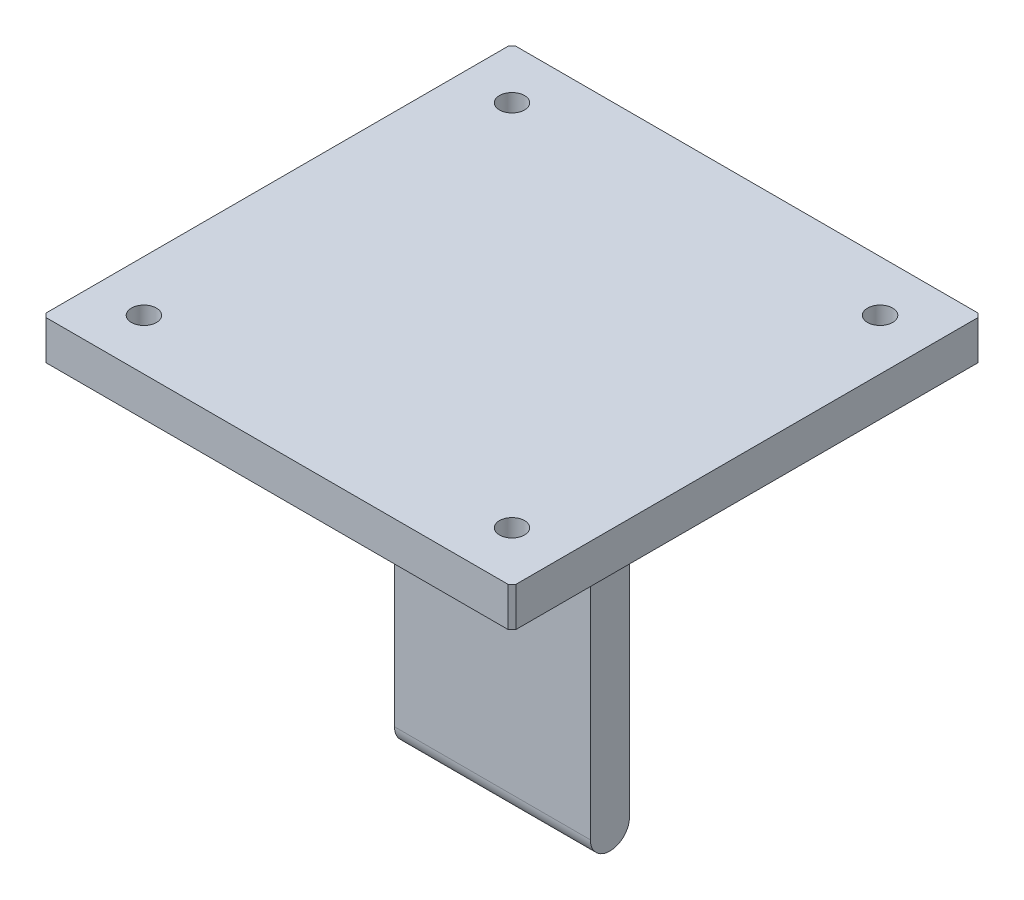
from build123d import *

# Parameters (mm, degrees)
SKIZZE1_W                       = 60
SKIZZE1_H                       = 60
AUFSATZ_LINEAR_AUSTRAGEN1_DEPTH = 5
SKIZZE7_R                       = 1.6
SCHNITT_LINEAR_AUSTRAGEN1_DEPTH = 10
FASE1_SIZE                      = 0.5
SKIZZE8_W                       = 25
SKIZZE8_H                       = 5
AUFSATZ_LINEAR_AUSTRAGEN2_DEPTH = 48
VERRUNDUNG3_R                   = 2.5


with BuildPart() as part:
    # Skizze1 → Aufsatz-Linear austragen1 (new body)
    with BuildSketch(Plane(origin=(0, 0, 0), x_dir=(1, 0, 0), z_dir=(0, 1, 0))):
        with Locations((25, 30)):
            Rectangle(SKIZZE1_W, SKIZZE1_H)
    extrude(amount=AUFSATZ_LINEAR_AUSTRAGEN1_DEPTH)

    # Skizze7 → Schnitt-Linear austragen1 (cut)
    with BuildSketch(Plane(origin=(0, 5, 0), x_dir=(1, 0, 0), z_dir=(0, 1, 0))):
        with Locations(Location((1.5, 53.5, 0), (0, 0, 270))):
            Circle(SKIZZE7_R)
        with Locations(Location((48.5, 53.5, 0), (0, 0, 270))):
            Circle(SKIZZE7_R)
        with Locations(Location((48.5, 6.5, 0), (0, 0, 270))):
            Circle(SKIZZE7_R)
        with Locations(Location((1.5, 6.5, 0), (0, 0, 270))):
            Circle(SKIZZE7_R)
    extrude(amount=-SCHNITT_LINEAR_AUSTRAGEN1_DEPTH, mode=Mode.SUBTRACT)

    # Fase1
    fase1_edges = [part.edges().sort_by_distance(p)[0] for p in [
        (-5, 2.5, -60),
        (55, 2.5, -60),
        (55, 2.5, 0),
        (-5, 2.5, 0),
    ]]
    chamfer(fase1_edges, length=FASE1_SIZE)

    # Skizze8 → Aufsatz-Linear austragen2 (add)
    with BuildSketch(Plane.XZ):
        with Locations((25, -30)):
            Rectangle(SKIZZE8_W, SKIZZE8_H)
    extrude(amount=AUFSATZ_LINEAR_AUSTRAGEN2_DEPTH)

    # Verrundung3
    verrundung3_edges = [part.edges().sort_by_distance(p)[0] for p in [
        (25, -48, -32.5),
        (25, -48, -27.5),
    ]]
    fillet(verrundung3_edges, radius=VERRUNDUNG3_R - 0.0001)  # a hair under: the kernel refuses the full size


solid = part.part
